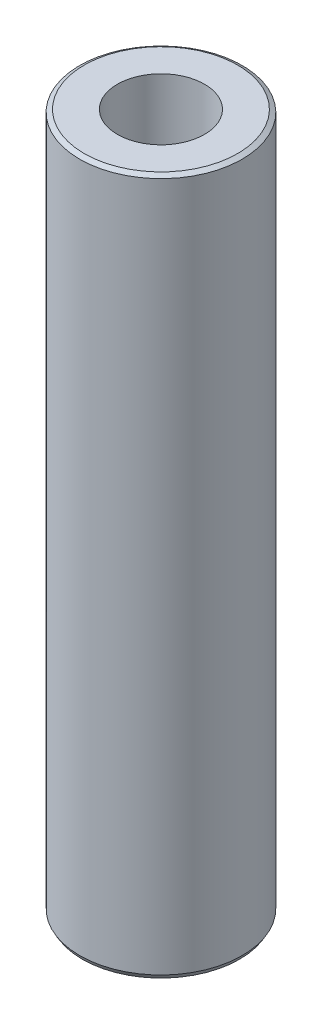
from build123d import *
from OCP.BRepFilletAPI import BRepFilletAPI_MakeChamfer

# Parameters (mm, degrees)
SKETCH1_R           = 42.5
BOSS_EXTRUDE1_DEPTH = 364.540746162
SKETCH2_R           = 22.781610954
CUT_EXTRUDE1_DEPTH  = 370.462387277
CHAMFER1_SIZE       = 1.366917904
CHAMFER1_SIZE2      = 2.36757126


with BuildPart() as part:
    # Sketch1 → Boss-Extrude1 (new body)
    with BuildSketch(Plane(origin=(0, 0, 0), x_dir=(1, 0, 0), z_dir=(0, 1, 0))):
        Circle(SKETCH1_R)
    extrude(amount=BOSS_EXTRUDE1_DEPTH)

    # Sketch2 → Cut-Extrude1 (cut, through all)
    with BuildSketch(Plane(origin=(0, 0, 0), x_dir=(1, 0, 0), z_dir=(0, 1, 0))):
        Circle(SKETCH2_R)
    extrude(amount=CUT_EXTRUDE1_DEPTH, mode=Mode.SUBTRACT)

    # Chamfer1: one chamfer whose edges measure the first distance from different faces: ONE call of the kernel's chamfer builder (chamfer() names one face for all edges)
    chamfer1_edges_1 = [part.edges().sort_by_distance(p)[0] for p in [
        (-42.5, 364.540746162, 0),
    ]]
    chamfer1_side_1 = [part.faces().sort_by_distance(p)[0] for p in [
        (-42.5, 182.270373081, 0),
    ]]
    chamfer1_edges_2 = [part.edges().sort_by_distance(p)[0] for p in [
        (-42.5, 0, 0),
    ]]
    chamfer1_side_2 = [part.faces().sort_by_distance(p)[0] for p in [
        (-41.297918472, 0, 0),
    ]]
    chamfer1 = BRepFilletAPI_MakeChamfer(part.part.solid().wrapped)
    for e in chamfer1_edges_1:
        chamfer1.Add(CHAMFER1_SIZE, CHAMFER1_SIZE2, e.wrapped, chamfer1_side_1[0].wrapped)  # the first distance lies on this face
    for e in chamfer1_edges_2:
        chamfer1.Add(CHAMFER1_SIZE, CHAMFER1_SIZE2, e.wrapped, chamfer1_side_2[0].wrapped)  # the first distance lies on this face
    add(Compound.cast(chamfer1.Shape()), mode=Mode.REPLACE)


solid = part.part
